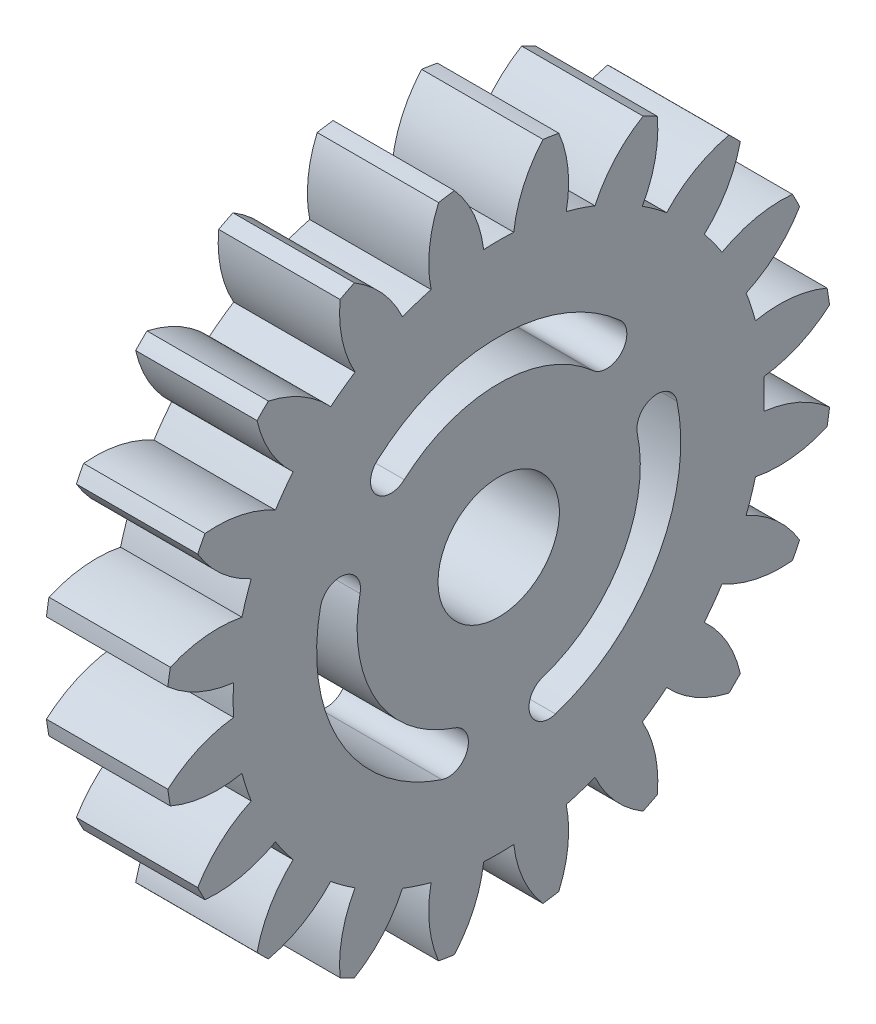
from build123d import *

# Parameters (mm, degrees)
BASPROSKE_W        = 6
BASPROSKE_H        = 16.5
TOOTHCUT_DEPTH     = 25.093567606
TEETHCUTS_COUNT    = 20
TEETHCUTS_ANGLE    = 342
BORSKE_R           = 3
BORE_DEPTH         = 50.0000508
CUT_EXTRUDE1_DEPTH = 10
CIRPATTERN1_COUNT  = 3


with BuildPart() as part:
    # BasProSke → Base-Revolve (revolve)
    with BuildSketch(Plane(origin=(0, 0, 0), x_dir=(1, 0, 0), z_dir=(0, 1, 0))):
        with Locations((3, 8.25)):
            Rectangle(BASPROSKE_W, BASPROSKE_H)
    revolve(axis=Axis((-10, 0, 0), (1, 0, 0)))

    # TooCutSke → ToothCut (cut, through all)
    with BuildSketch(Plane(origin=(0, 0, 0), x_dir=(0, 0, -1), z_dir=(1, 0, 0))):
        with BuildLine():
            ThreePointArc((0.74381438, 13.102904875), (0, 13.124), (-0.74381438, 13.102904875))
            ThreePointArc((-0.74381438, 13.102904875), (-1.226473103, 14.852072512), (-2.209965745, 16.376962373))
            ThreePointArc((-2.209965745, 16.376962373), (0, 16.5254), (2.209965745, 16.376962373))
            ThreePointArc((2.209965745, 16.376962373), (1.226473103, 14.852072512), (0.74381438, 13.102904875))
        make_face()
    toothcut = extrude(amount=TOOTHCUT_DEPTH, mode=Mode.SUBTRACT)

    # TeethCuts: ToothCut ×20 about axis
    teethcuts_axis = Axis((-10, 0, 0), (1, 0, 0))
    for i in range(1, TEETHCUTS_COUNT):
        add(toothcut.rotate(teethcuts_axis, i * TEETHCUTS_ANGLE / (TEETHCUTS_COUNT - 1)), mode=Mode.SUBTRACT)

    # BorSke → Bore (cut, symmetric)
    with BuildSketch(Plane(origin=(0, 0, 0), x_dir=(0, 0, -1), z_dir=(1, 0, 0))):
        Circle(BORSKE_R)
    extrude(amount=BORE_DEPTH, both=True, mode=Mode.SUBTRACT)

    # Sketch1 → Cut-Extrude1 (cut)
    with BuildSketch(Plane(origin=(6, 0, 0), x_dir=(0, 0, -1), z_dir=(1, 0, 0))):
        with BuildLine():
            ThreePointArc((6, 6.708203932), (0, 9), (-6, 6.708203932))
            ThreePointArc((-6, 6.708203932), (-6.078689326, 5.296181273), (-4.666666667, 5.217491947))
            ThreePointArc((-4.666666667, 5.217491947), (0, 7), (4.666666667, 5.217491947))
            ThreePointArc((4.666666667, 5.217491947), (6.078689326, 5.296181273), (6, 6.708203932))
        make_face()
    cut_extrude1 = extrude(amount=-CUT_EXTRUDE1_DEPTH, mode=Mode.SUBTRACT)

    # CirPattern1: Cut-Extrude1 ×3 about axis
    cirpattern1_axis = Axis((6, 0, 0), (1, 0, 0))
    for i in range(1, CIRPATTERN1_COUNT):
        add(cut_extrude1.rotate(cirpattern1_axis, i * 360 / CIRPATTERN1_COUNT), mode=Mode.SUBTRACT)


solid = part.part
